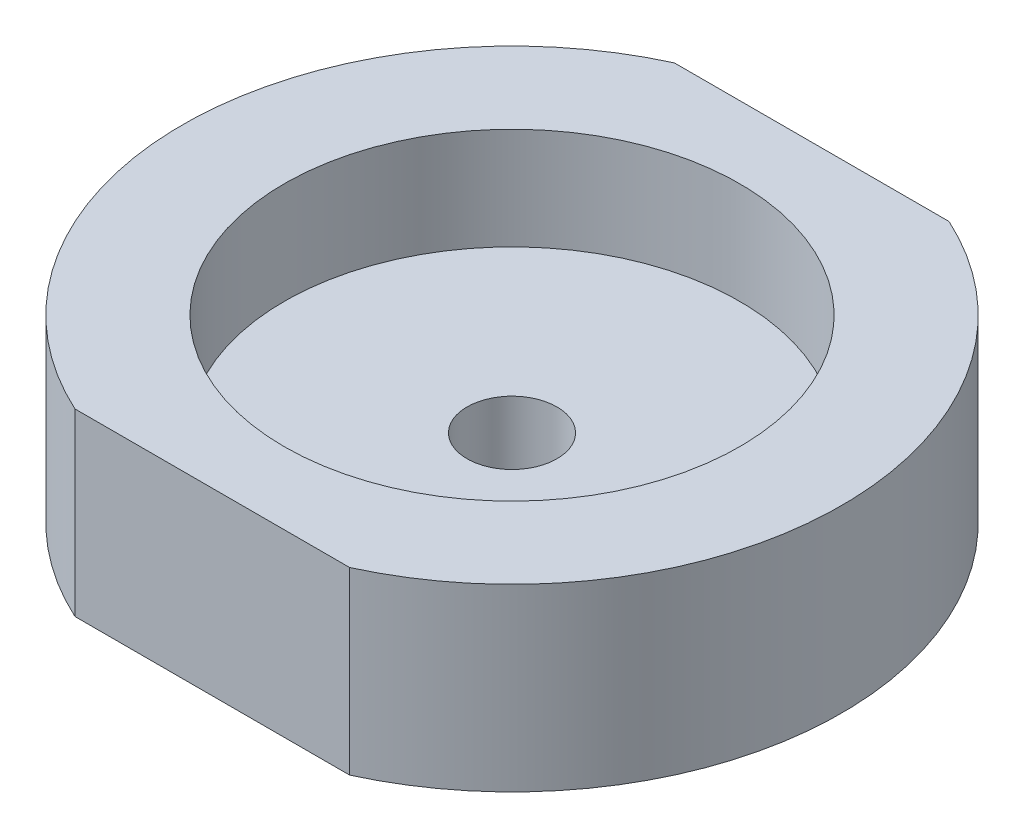
from build123d import *

# Parameters (mm, degrees)
EXTRUDE_1_DEPTH     = 3
SKETCH_2_R          = 3.8
CUT_EXTRUDE_1_DEPTH = 1.7
SKETCH_3_R          = 0.75
CUT_EXTRUDE_2_DEPTH = 8.624959016


with BuildPart() as part:
    # 草图1 → 凸台-拉伸1 (new body)
    with BuildSketch(Plane(origin=(0, 0, 0), x_dir=(1, 0, 0), z_dir=(0, 1, 0))):
        with BuildLine():
            ThreePointArc((-2.291287847, 5), (-5.5, 0), (-2.291287847, -5))
            Line((-2.291287847, -5), (2.291287847, -5))
            ThreePointArc((2.291287847, -5), (5.5, 0), (2.291287847, 5))
            Line((2.291287847, 5), (-2.291287847, 5))
        make_face()
    extrude(amount=EXTRUDE_1_DEPTH)

    # 草图2 → 切除-拉伸1 (cut)
    with BuildSketch(Plane(origin=(0, 3, 0), x_dir=(1, 0, 0), z_dir=(0, 1, 0))):
        Circle(SKETCH_2_R)
    extrude(amount=-CUT_EXTRUDE_1_DEPTH, mode=Mode.SUBTRACT)

    # 草图3 → 切除-拉伸2 (cut, through all)
    with BuildSketch(Plane(origin=(0, 1.3, 0), x_dir=(-1, 0, 0), z_dir=(0, -1, 0))):
        Circle(SKETCH_3_R)
    extrude(amount=CUT_EXTRUDE_2_DEPTH, mode=Mode.SUBTRACT)


solid = part.part
